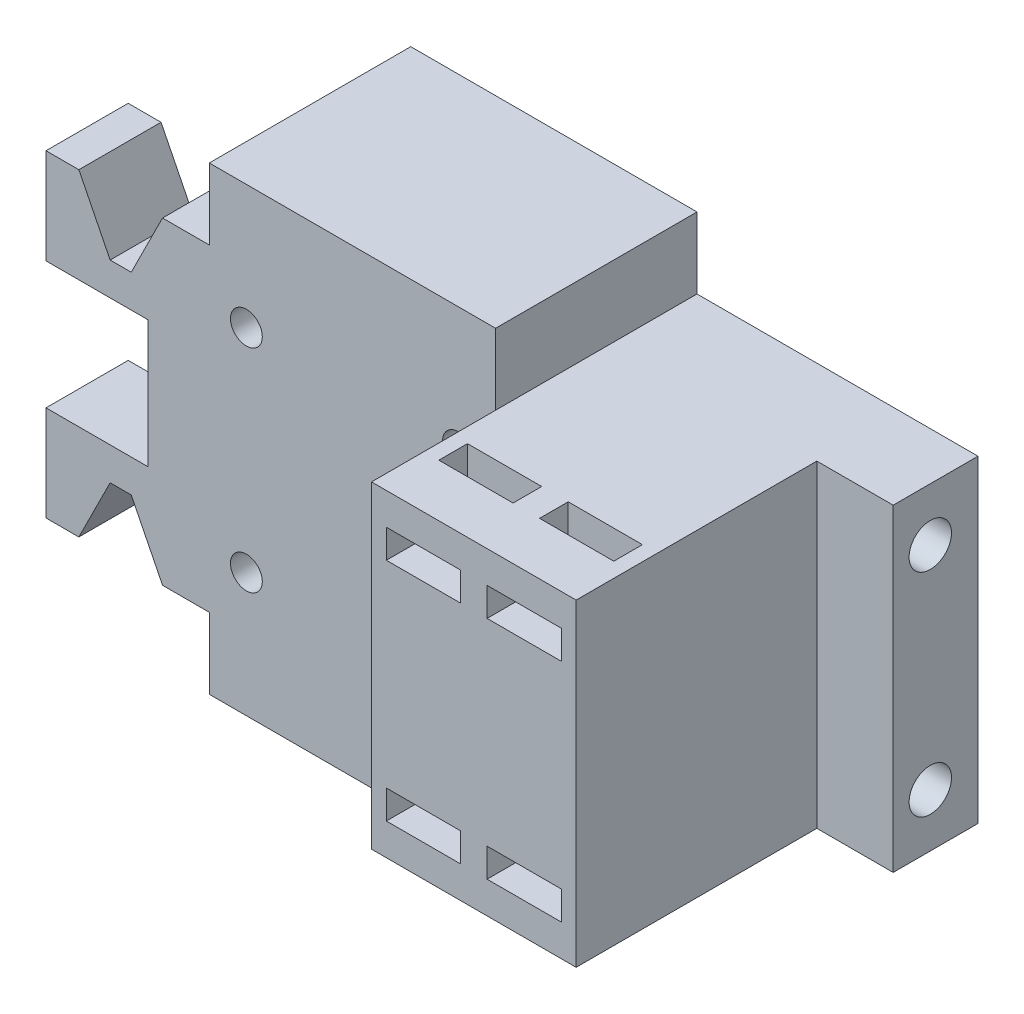
from build123d import *

# Parameters (mm, degrees)
BOSS_EXTRUDE1_DEPTH                     = 19
EARKNOTCH_SKETCH2_W                     = 15.4
EARKNOTCH_SKETCH2_H                     = 30
EARKNOTCH_CUT_EXTRUDE1_DEPTH            = 11.25
TOPHOLES_SKETCH3_R                      = 2
TOPHOLES_CUT_EXTRUDE2_DEPTH             = 4
FRONTHOLES_SKETCH1_R                    = 2
FRONTHOLES_CUT_EXTRUDE1_DEPTH           = 7
REARMOUNTINGHOLES_SKETCH2_R             = 1.5
REARMOUNTINGHOLES_CUT_EXTRUDE2_DEPTH    = 81.34363696
REARMOUNTINGHOLESBORESKETCH4_R          = 2.75
REARMOUNTINGHOLESBORECUT_EXTRUDE2_DEPTH = 4
BLOCKUNDERRAIL_SKETCH1_W                = 26.5
BLOCKUNDERRAIL_SKETCH1_H                = 30
BLOCKUNDERRAIL_BOSS_EXTRUDE2_DEPTH      = 11.7
REARRIBBONHOLES_SKETCH2_W               = 7
REARRIBBONHOLES_SKETCH2_H               = 2.7
REARRIBBONHOLES_CUT_EXTRUDE1_DEPTH      = 7.65
RIGHTRIBBONHOLES_SKETCH4_W              = 7
RIGHTRIBBONHOLES_SKETCH4_H              = 2.7
RIGHTRIBBONHOLES_CUT_EXTRUDE2_DEPTH     = 5.7
LEFTRIBBONHOLES_SKETCH3_W               = 7
LEFTRIBBONHOLES_SKETCH3_H               = 2.7
LEFTRIBBONHOLES_CUT_EXTRUDE2_DEPTH      = 5.7
BOTTOMCLAMPMOUNTINGHOLESSKETCH3_R       = 2
BOTTOMCLAMPMOUNTHOLESCUT_EXTRUDE1_DEPTH = 4.1
RIBBONHOLEFILLET1_R                     = 2.7
RIBBONHOLEFILLET2_R                     = 2.7
RIBBONHOLEFILLET3_R                     = 2.7
RIBBONHOLEFILLET4_R                     = 2.7
EXCESSENDSKETCH1_W                      = 7.2
EXCESSENDSKETCH1_H                      = 30
EXCESSENDCUT_EXTRUDE1_DEPTH             = 22.7


with BuildPart() as part:
    # BackFace-Sketch1 → Boss-Extrude1 (new body)
    with BuildSketch(Plane.XY):
        Polygon((0, 0), (0, 9), (9.6, 9), (9.6, 21), (0, 21), (0, 30), (3.1, 30), (6.05, 24.095975949), (8.04, 24.095975949), (10.99, 30), (15.4, 30), (15.4, 36.7), (42.4, 36.7), (42.4, 30), (68.9, 30), (68.9, 0), (42.4, 0), (42.4, -6.7), (15.4, -6.7), (15.4, 0), (10.99, 0), (8.04, 5.904024051), (6.05, 5.904024051), (3.1, 0), align=None)
    extrude(amount=BOSS_EXTRUDE1_DEPTH)

    # EarKnotch-Sketch2 → EarKnotch-Cut-Extrude1 (cut)
    with BuildSketch(Plane(origin=(0, 0, 0), x_dir=(-1, 0, 0), z_dir=(0, 0, -1))):
        with Locations((-7.7, 15)):
            Rectangle(EARKNOTCH_SKETCH2_W, EARKNOTCH_SKETCH2_H)
    extrude(amount=-EARKNOTCH_CUT_EXTRUDE1_DEPTH, mode=Mode.SUBTRACT)

    # TopHoles-Sketch3 → TopHoles-Cut-Extrude2 (cut)
    with BuildSketch(Plane.ZY):
        with Locations((14.5, 25.5)):
            Circle(TOPHOLES_SKETCH3_R)
        with Locations((14.5, 4.5)):
            Circle(TOPHOLES_SKETCH3_R)
    extrude(amount=-TOPHOLES_CUT_EXTRUDE2_DEPTH, mode=Mode.SUBTRACT)

    # FrontHoles-Sketch1 → FrontHoles-Cut-Extrude1 (cut)
    with BuildSketch(Plane(origin=(0, 0, 0), x_dir=(-1, 0, 0), z_dir=(0, 0, -1))):
        with Locations((-45.25, 25)):
            Circle(FRONTHOLES_SKETCH1_R)
        with Locations((-45.25, 5)):
            Circle(FRONTHOLES_SKETCH1_R)
        with Locations((-33.25, 25)):
            Circle(FRONTHOLES_SKETCH1_R)
        with Locations((-33.25, 5)):
            Circle(FRONTHOLES_SKETCH1_R)
    extrude(amount=-FRONTHOLES_CUT_EXTRUDE1_DEPTH, mode=Mode.SUBTRACT)

    # RearMountingHoles-Sketch2 → RearMountingHoles-Cut-Extrude2 (cut, through all)
    with BuildSketch(Plane.XY.offset(19)):
        with Locations((18.9, 25)):
            Circle(REARMOUNTINGHOLES_SKETCH2_R)
        with Locations((18.9, 5)):
            Circle(REARMOUNTINGHOLES_SKETCH2_R)
        with Locations((38.9, 25)):
            Circle(REARMOUNTINGHOLES_SKETCH2_R)
        with Locations((38.9, 5)):
            Circle(REARMOUNTINGHOLES_SKETCH2_R)
    extrude(amount=-REARMOUNTINGHOLES_CUT_EXTRUDE2_DEPTH, mode=Mode.SUBTRACT)

    # RearMountingHolesBoreSketch4 → RearMountingHolesBoreCut-Extrude2 (cut)
    with BuildSketch(Plane(origin=(0, 0, 0), x_dir=(-1, 0, 0), z_dir=(0, 0, -1))):
        with Locations((-38.9, 25)):
            Circle(REARMOUNTINGHOLESBORESKETCH4_R)
        with Locations((-18.9, 25)):
            Circle(REARMOUNTINGHOLESBORESKETCH4_R)
        with Locations((-38.9, 5)):
            Circle(REARMOUNTINGHOLESBORESKETCH4_R)
        with Locations((-18.9, 5)):
            Circle(REARMOUNTINGHOLESBORESKETCH4_R)
    extrude(amount=-REARMOUNTINGHOLESBORECUT_EXTRUDE2_DEPTH, mode=Mode.SUBTRACT)

    # BlockUnderRail-Sketch1 → BlockUnderRail-Boss-Extrude2 (add)
    with BuildSketch(Plane.XY.offset(19)):
        with Locations((55.65, 15)):
            Rectangle(BLOCKUNDERRAIL_SKETCH1_W, BLOCKUNDERRAIL_SKETCH1_H)
    extrude(amount=BLOCKUNDERRAIL_BOSS_EXTRUDE2_DEPTH)

    # RearRibbonHoles-Sketch2 → RearRibbonHoles-Cut-Extrude1 (cut)
    with BuildSketch(Plane.XY.offset(30.7)):
        with Locations((47.3, 25.65)):
            Rectangle(REARRIBBONHOLES_SKETCH2_W, REARRIBBONHOLES_SKETCH2_H)
        with Locations((56.8, 25.65)):
            Rectangle(REARRIBBONHOLES_SKETCH2_W, REARRIBBONHOLES_SKETCH2_H)
        with Locations((47.3, 4.35)):
            Rectangle(REARRIBBONHOLES_SKETCH2_W, REARRIBBONHOLES_SKETCH2_H)
        with Locations((56.8, 4.35)):
            Rectangle(REARRIBBONHOLES_SKETCH2_W, REARRIBBONHOLES_SKETCH2_H)
    extrude(amount=-REARRIBBONHOLES_CUT_EXTRUDE1_DEPTH, mode=Mode.SUBTRACT)

    # RightRibbonHoles-Sketch4 → RightRibbonHoles-Cut-Extrude2 (cut)
    with BuildSketch(Plane(origin=(0, 30, 0), x_dir=(1, 0, 0), z_dir=(0, 1, 0))):
        with Locations((47.3, -24.4)):
            Rectangle(RIGHTRIBBONHOLES_SKETCH4_W, RIGHTRIBBONHOLES_SKETCH4_H)
        with Locations((56.8, -24.4)):
            Rectangle(RIGHTRIBBONHOLES_SKETCH4_W, RIGHTRIBBONHOLES_SKETCH4_H)
    extrude(amount=-RIGHTRIBBONHOLES_CUT_EXTRUDE2_DEPTH, mode=Mode.SUBTRACT)

    # LeftRibbonHoles-Sketch3 → LeftRibbonHoles-Cut-Extrude2 (cut)
    with BuildSketch(Plane.XZ):
        with Locations((47.3, 24.4)):
            Rectangle(LEFTRIBBONHOLES_SKETCH3_W, LEFTRIBBONHOLES_SKETCH3_H)
        with Locations((56.8, 24.4)):
            Rectangle(LEFTRIBBONHOLES_SKETCH3_W, LEFTRIBBONHOLES_SKETCH3_H)
    extrude(amount=-LEFTRIBBONHOLES_CUT_EXTRUDE2_DEPTH, mode=Mode.SUBTRACT)

    # BottomClampMountingHolesSketch3 → BottomClampMountHolesCut-Extrude1 (cut)
    with BuildSketch(Plane(origin=(68.9, 0, 0), x_dir=(0, 0, -1), z_dir=(1, 0, 0))):
        with Locations((-4.5, 25)):
            Circle(BOTTOMCLAMPMOUNTINGHOLESSKETCH3_R)
        with Locations((-4.5, 5)):
            Circle(BOTTOMCLAMPMOUNTINGHOLESSKETCH3_R)
    extrude(amount=-BOTTOMCLAMPMOUNTHOLESCUT_EXTRUDE1_DEPTH, mode=Mode.SUBTRACT)

    # RibbonHoleFillet1
    ribbonholefillet1_edges = [part.edges().sort_by_distance(p)[0] for p in [
        (56.8, 5.7, 23.05),
    ]]
    fillet(ribbonholefillet1_edges, radius=RIBBONHOLEFILLET1_R)

    # RibbonHoleFillet2
    ribbonholefillet2_edges = [part.edges().sort_by_distance(p)[0] for p in [
        (47.3, 5.7, 23.05),
    ]]
    fillet(ribbonholefillet2_edges, radius=RIBBONHOLEFILLET2_R)

    # RibbonHoleFillet3
    ribbonholefillet3_edges = [part.edges().sort_by_distance(p)[0] for p in [
        (56.8, 24.3, 23.05),
    ]]
    fillet(ribbonholefillet3_edges, radius=RIBBONHOLEFILLET3_R)

    # RibbonHoleFillet4
    ribbonholefillet4_edges = [part.edges().sort_by_distance(p)[0] for p in [
        (47.3, 24.3, 23.05),
    ]]
    fillet(ribbonholefillet4_edges, radius=RIBBONHOLEFILLET4_R)

    # ExcessEndSketch1 → ExcessEndCut-Extrude1 (cut)
    with BuildSketch(Plane.XY.offset(30.7)):
        with Locations((65.3, 15)):
            Rectangle(EXCESSENDSKETCH1_W, EXCESSENDSKETCH1_H)
    extrude(amount=-EXCESSENDCUT_EXTRUDE1_DEPTH, mode=Mode.SUBTRACT)


solid = part.part
